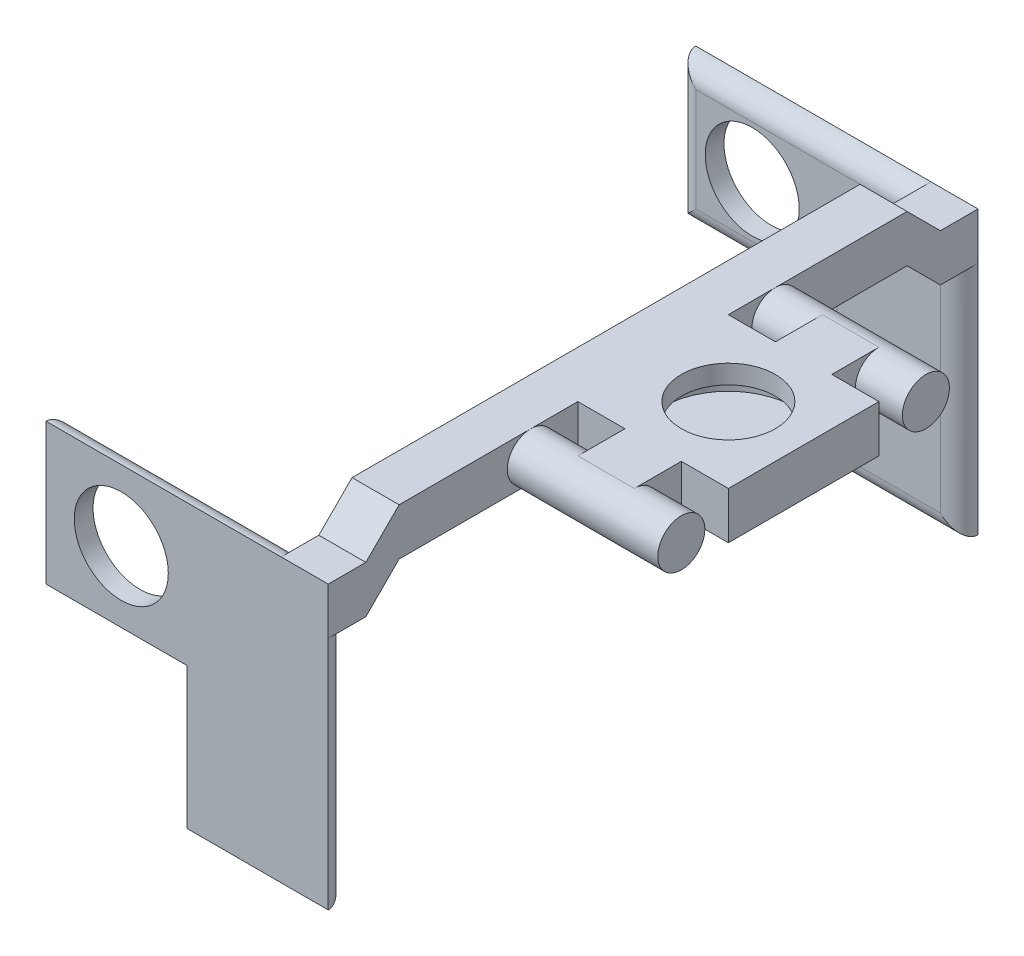
from build123d import *

# Parameters (mm, degrees)
SKETCH1_W            = 5
SKETCH1_H            = 54
BOSS_EXTRUDE1_DEPTH  = 5
SKETCH3_W            = 16
SKETCH3_H            = 16
BOSS_EXTRUDE2_DEPTH  = 5
SKETCH6_W            = 5
SKETCH6_H            = 5
BOSS_EXTRUDE5_DEPTH  = 5
SKETCH10_W           = 30
SKETCH10_H           = 15
BOSS_EXTRUDE9_DEPTH  = 4
CUT_EXTRUDE1_DEPTH   = 2
CUT_EXTRUDE2_REACH   = 71.784
SKETCH11_R           = 5
SKETCH13_W           = 15
SKETCH13_H           = 2
BOSS_EXTRUDE10_DEPTH = 15
SKETCH4_R            = 5
CUT_EXTRUDE3_DEPTH   = 2
SKETCH14_R           = 7
CUT_EXTRUDE4_DEPTH   = 2
SKETCH16_W           = 6
SKETCH16_H           = 5
BOSS_EXTRUDE11_DEPTH = 5
BOSS_EXTRUDE12_START = -11
SKETCH17_R           = 2.5
BOSS_EXTRUDE12_DEPTH = 16
FILLET1_R            = 2


with BuildPart() as part:
    # Sketch1 → Boss-Extrude1 (new body)
    with BuildSketch(Plane(origin=(0, 0, 0), x_dir=(1, 0, 0), z_dir=(0, 1, 0))):
        with Locations((-2.5, 0)):
            Rectangle(SKETCH1_W, SKETCH1_H)
    extrude(amount=BOSS_EXTRUDE1_DEPTH)

    # Sketch3 → Boss-Extrude2 (add)
    with BuildSketch(Plane(origin=(0, 0, 0), x_dir=(1, 0, 0), z_dir=(0, 1, 0))):
        with Locations((8, 0)):
            Rectangle(SKETCH3_W, SKETCH3_H)
    extrude(amount=BOSS_EXTRUDE2_DEPTH)

    # Sketch6 → Boss-Extrude5 (add, along a direction that is not the sketch's normal)
    with BuildSketch(Plane.XY.offset(27)):
        with Locations((-2.5, 2.5)):
            Rectangle(SKETCH6_W, SKETCH6_H)
    boss_extrude5 = extrude(amount=BOSS_EXTRUDE5_DEPTH, dir=(0, -0.7071067811865479, 0.7071067811865472))

    # Sketch10 → Boss-Extrude9 (add)
    with BuildSketch(Plane.XY.offset(30.535533906)):
        with Locations((-15, -6.035533906)):
            Rectangle(SKETCH10_W, SKETCH10_H)
    boss_extrude9 = extrude(amount=BOSS_EXTRUDE9_DEPTH)

    # Sketch12 → Cut-Extrude1 (cut)
    with BuildSketch(Plane(origin=(0, 0, 30.535533906), x_dir=(-1, 0, 0), z_dir=(0, 0, -1))):
        Polygon((30, -13.535533906), (30, 1.464466094), (5, 1.464466094), (5, -3.535533906), (0, -3.535533906), (0, -13.535533906), align=None)
    cut_extrude1 = extrude(amount=-CUT_EXTRUDE1_DEPTH, mode=Mode.SUBTRACT)

    # Sketch11 → Cut-Extrude2 (cut, up to next)
    with BuildSketch(Plane.XY.offset(34.535533906), mode=Mode.PRIVATE) as cut_extrude2_sk1:
        with Locations((-22, -6.035533906)):
            Circle(SKETCH11_R)
    cut_extrude2_tool1 = extrude(cut_extrude2_sk1.sketch, amount=-CUT_EXTRUDE2_REACH, mode=Mode.PRIVATE) & part.part
    cut_extrude2 = cut_extrude2_tool1.solids().sort_by_distance((-22, -6.035534, 34.535534))[0]
    add(cut_extrude2, mode=Mode.SUBTRACT)

    # Sketch13 → Boss-Extrude10 (add)
    with BuildSketch(Plane.XZ.offset(13.535533906)):
        with Locations((-7.5, 33.535533906)):
            Rectangle(SKETCH13_W, SKETCH13_H)
    boss_extrude10 = extrude(amount=BOSS_EXTRUDE10_DEPTH)

    # Sketch4 → Cut-Extrude3 (cut)
    with BuildSketch(Plane(origin=(0, 5, 0), x_dir=(1, 0, 0), z_dir=(0, 1, 0))):
        with Locations(Location((8, 0, 0), (0, 0, 270))):
            Circle(SKETCH4_R)
    extrude(amount=-CUT_EXTRUDE3_DEPTH, mode=Mode.SUBTRACT)

    # Sketch14 → Cut-Extrude4 (cut)
    with BuildSketch(Plane(origin=(0, 3, 0), x_dir=(1, 0, 0), z_dir=(0, 1, 0))):
        with Locations(Location((8, 0, 0), (0, 0, 270))):
            Circle(SKETCH14_R)
    extrude(amount=-CUT_EXTRUDE4_DEPTH, mode=Mode.SUBTRACT)

    # Sketch16 → Boss-Extrude11 (add)
    with BuildSketch(Plane.XY.offset(8)):
        with Locations((8, 2.5)):
            Rectangle(SKETCH16_W, SKETCH16_H)
    boss_extrude11 = extrude(amount=BOSS_EXTRUDE11_DEPTH)

    # Sketch17 → Boss-Extrude12 (add)
    with BuildSketch(Plane(origin=(11, 0, 0), x_dir=(0, 0, -1), z_dir=(1, 0, 0)).offset(BOSS_EXTRUDE12_START)):
        with Locations((-13, 2.5)):
            Circle(SKETCH17_R)
    boss_extrude12 = extrude(amount=BOSS_EXTRUDE12_DEPTH)

    # Mirror2: Boss-Extrude5, Boss-Extrude9, Cut-Extrude1, Cut-Extrude2, Boss-Extrude10, Boss-Extrude11, Boss-Extrude12 across plane
    add(boss_extrude5.mirror(Plane.XY))
    add(boss_extrude9.mirror(Plane.XY))
    add(cut_extrude1.mirror(Plane.XY), mode=Mode.SUBTRACT)
    add(cut_extrude2.mirror(Plane.XY), mode=Mode.SUBTRACT)
    add(boss_extrude10.mirror(Plane.XY))
    add(boss_extrude11.mirror(Plane.XY))
    add(boss_extrude12.mirror(Plane.XY))

    # Fillet1
    fillet1_edges = [part.edges().sort_by_distance(p)[0] for p in [
        (0, -16.035533906, -32.535533906),
        (0, -16.035533906, 32.535533906),
        (-7.5, -28.535533906, 32.535533906),
        (-17.5, 1.464466094, -32.535533906),
        (-30, -6.035533906, -32.535533906),
        (-22.5, -13.535533906, -32.535533906),
        (-15, -21.035533906, -32.535533906),
        (-7.5, -28.535533906, -32.535533906),
        (-17.5, 1.464466094, 32.535533906),
        (-30, -6.035533906, 32.535533906),
        (-22.5, -13.535533906, 32.535533906),
        (-15, -21.035533906, 32.535533906),
    ]]
    fillet(fillet1_edges, radius=FILLET1_R - 0.0001)  # a hair under: the kernel refuses the full size


solid = part.part
